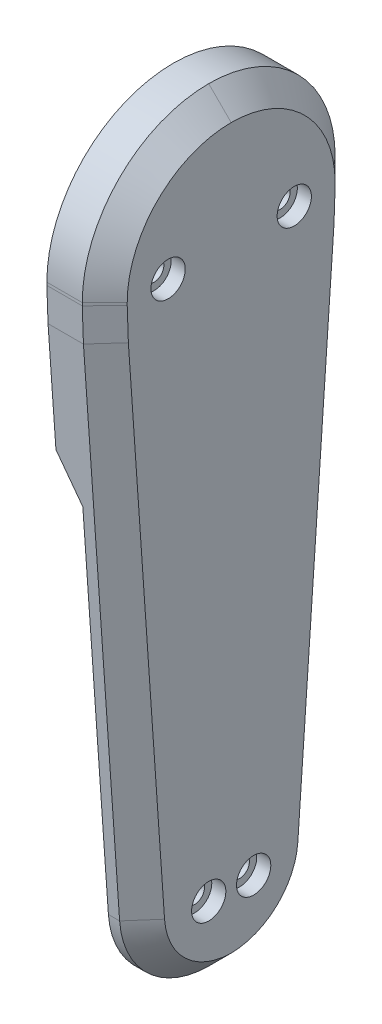
from build123d import *
from OCP.BRepFilletAPI import BRepFilletAPI_MakeChamfer

# Parameters (mm, degrees)
SKETCH1_W           = 20
SKETCH1_H           = 20
BOSS_EXTRUDE1_DEPTH = 20
SKETCH2_W           = 45
SKETCH2_H           = 70
BOSS_EXTRUDE2_DEPTH = 8.3
CUT_EXTRUDE1_DEPTH  = 5.8
FILLET1_R           = 3.6
FILLET2_R           = 10
SKETCH5_R           = 3.9
CUT_EXTRUDE2_DEPTH  = 51.320373608
CUT_EXTRUDE3_REACH  = 49.302
SKETCH6_R           = 1.75
SKETCH13_W          = 20
SKETCH13_H          = 20
CUT_EXTRUDE9_DEPTH  = 20
SKETCH15_W          = 8.3
SKETCH15_H          = 45
CUT_EXTRUDE10_DEPTH = 12.5
SKETCH18_W          = 8.3
SKETCH18_H          = 45
BOSS_EXTRUDE4_DEPTH = 78.5
FILLET5_R           = 22.5
SKETCH20_W          = 45
SKETCH20_H          = 80
CUT_EXTRUDE12_DEPTH = 2.3
CHAMFER2_SIZE       = 110
CHAMFER2_SIZE2      = 7.691949314
CHAMFER3_SIZE       = 3
FILLET6_R           = 16
CHAMFER4_SIZE       = 4
SKETCH21_R          = 1.75
CUT_EXTRUDE15_DEPTH = 116.863759268
SKETCH14_R          = 1.75
CUT_EXTRUDE16_DEPTH = 117.005606381
SKETCH23_W          = 17
SKETCH23_H          = 38.9
BOSS_EXTRUDE5_DEPTH = 8.3
BOSS_EXTRUDE6_START = 2
SKETCH24_R          = 1.75
BOSS_EXTRUDE6_DEPTH = 2
CHAMFER5_SIZE2      = 4.3
CHAMFER5_SIZE       = 6.881438475
SKETCH25_R          = 3.05
CUT_EXTRUDE17_DEPTH = 2.5


# Some blends are built 0.0001 mm under size
with BuildPart() as part:
    # Sketch1 → Boss-Extrude1 (new body)
    with BuildSketch(Plane(origin=(0, 0, 0), x_dir=(0, 0, -1), z_dir=(1, 0, 0))):
        Rectangle(SKETCH1_W, SKETCH1_H)
    extrude(amount=BOSS_EXTRUDE1_DEPTH)

    # Sketch2 → Boss-Extrude2 (add)
    with BuildSketch(Plane(origin=(20, 0, 0), x_dir=(0, 0, -1), z_dir=(1, 0, 0))):
        Rectangle(SKETCH2_W, SKETCH2_H)
    extrude(amount=BOSS_EXTRUDE2_DEPTH)

    # Sketch4 → Cut-Extrude1 (cut)
    with BuildSketch(Plane(origin=(28.3, 0, 0), x_dir=(0, 0, -1), z_dir=(1, 0, 0))):
        with BuildLine():
            Line((3.6, -28.55), (-3.6, -28.55))
            Line((-3.6, -28.55), (-3.6, -7.311805523))
            ThreePointArc((-3.6, -7.311805523), (0, 8.15), (3.6, -7.311805523))
            Line((3.6, -7.311805523), (3.6, -28.55))
        make_face()
    extrude(amount=-CUT_EXTRUDE1_DEPTH, mode=Mode.SUBTRACT)

    # Fillet1
    fillet1_edges = [part.edges().sort_by_distance(p)[0] for p in [
        (25.4, -28.55, 3.6),
        (25.4, -28.55, -3.6),
    ]]
    fillet(fillet1_edges, radius=FILLET1_R - 0.0001)  # a hair under: the kernel refuses the full size

    # Fillet2
    fillet2_edges = [part.edges().sort_by_distance(p)[0] for p in [
        (25.4, -7.311805523, 3.6),
        (25.4, -7.311805523, -3.6),
    ]]
    fillet(fillet2_edges, radius=FILLET2_R)

    # Sketch5 → Cut-Extrude2 (cut, through all)
    with BuildSketch(Plane.ZY):
        Circle(SKETCH5_R)
    extrude(amount=-CUT_EXTRUDE2_DEPTH, mode=Mode.SUBTRACT)

    # Sketch6 → Cut-Extrude3 (cut, up to next)
    with BuildSketch(Plane(origin=(22.5, 0, 0), x_dir=(0, 0, -1), z_dir=(1, 0, 0)), mode=Mode.PRIVATE) as cut_extrude3_sk1:
        with Locations((0, -20.6)):
            Circle(SKETCH6_R)
    cut_extrude3_tool1 = extrude(cut_extrude3_sk1.sketch, amount=-CUT_EXTRUDE3_REACH, mode=Mode.PRIVATE) & part.part
    # Sketch6 → Cut-Extrude3 (cut, up to next)
    with BuildSketch(Plane(origin=(22.5, 0, 0), x_dir=(0, 0, -1), z_dir=(1, 0, 0)), mode=Mode.PRIVATE) as cut_extrude3_sk2:
        with Locations((0, -9.35)):
            Circle(SKETCH6_R)
    cut_extrude3_tool2 = extrude(cut_extrude3_sk2.sketch, amount=-CUT_EXTRUDE3_REACH, mode=Mode.PRIVATE) & part.part
    add(cut_extrude3_tool1.solids().sort_by_distance((22.5, -20.6, 0))[0], mode=Mode.SUBTRACT)
    add(cut_extrude3_tool2.solids().sort_by_distance((22.5, -9.35, 0))[0], mode=Mode.SUBTRACT)

    # Sketch13 → Cut-Extrude9 (cut)
    with BuildSketch(Plane.ZY):
        Rectangle(SKETCH13_W, SKETCH13_H)
    extrude(amount=-CUT_EXTRUDE9_DEPTH, mode=Mode.SUBTRACT)

    # Sketch15 → Cut-Extrude10 (cut)
    with BuildSketch(Plane(origin=(0, 35, 0), x_dir=(1, 0, 0), z_dir=(0, 1, 0))):
        with Locations((24.15, 0)):
            Rectangle(SKETCH15_W, SKETCH15_H)
    extrude(amount=-CUT_EXTRUDE10_DEPTH, mode=Mode.SUBTRACT)

    # Sketch18 → Boss-Extrude4 (add)
    with BuildSketch(Plane.XZ.offset(35)):
        with Locations((24.15, 0)):
            Rectangle(SKETCH18_W, SKETCH18_H)
    extrude(amount=BOSS_EXTRUDE4_DEPTH)

    # Fillet5
    fillet5_edges = [part.edges().sort_by_distance(p)[0] for p in [
        (24.15, 22.5, -22.5),
        (24.15, 22.5, 22.5),
    ]]
    fillet(fillet5_edges, radius=FILLET5_R - 0.0001)  # a hair under: the kernel refuses the full size

    # Sketch20 → Cut-Extrude12 (cut)
    with BuildSketch(Plane.ZY.offset(-20)):
        with Locations((0, -73.5)):
            Rectangle(SKETCH20_W, SKETCH20_H)
    extrude(amount=-CUT_EXTRUDE12_DEPTH, mode=Mode.SUBTRACT)

    # Chamfer2: one chamfer whose edges measure the first distance from different faces: ONE call of the kernel's chamfer builder (chamfer() names one face for all edges)
    chamfer2_edges_1 = [part.edges().sort_by_distance(p)[0] for p in [
        (25.3, -113.5, -22.5),
    ]]
    chamfer2_side_1 = [part.faces().sort_by_distance(p)[0] for p in [
        (24.878183359, -52.68424744, -22.5),
    ]]
    chamfer2_edges_2 = [part.edges().sort_by_distance(p)[0] for p in [
        (25.3, -113.5, 22.5),
    ]]
    chamfer2_side_2 = [part.faces().sort_by_distance(p)[0] for p in [
        (24.878183359, -52.68424744, 22.5),
    ]]
    chamfer2 = BRepFilletAPI_MakeChamfer(part.part.solid().wrapped)
    for e in chamfer2_edges_1:
        chamfer2.Add(CHAMFER2_SIZE, CHAMFER2_SIZE2, e.wrapped, chamfer2_side_1[0].wrapped)  # the first distance lies on this face
    for e in chamfer2_edges_2:
        chamfer2.Add(CHAMFER2_SIZE, CHAMFER2_SIZE2, e.wrapped, chamfer2_side_2[0].wrapped)  # the first distance lies on this face
    add(Compound.cast(chamfer2.Shape()), mode=Mode.REPLACE)

    # Chamfer3
    # the kernel refuses this chamfer: 3 mm, written as the material it takes off along each edge
    with BuildSketch(Plane(origin=(36.099824275, -3.5, -22.5), x_dir=(0, -0.9976567869548854, 0.06841736214481542), z_dir=(-1, 0, 0))) as chamfer3_piece_1:
        Polygon((CHAMFER3_SIZE * 0.99999909909, CHAMFER3_SIZE * 0.00134231857559), (-CHAMFER3_SIZE * 0.997656786955, CHAMFER3_SIZE * 0.0684173621448), (0, 0), align=None)
    extrude(amount=23.89964855, mode=Mode.SUBTRACT)
    with BuildSketch(Plane(origin=(12.200175725, -3.5, 22.5), x_dir=(0, 0.999999099090015, 0.0013423185755924486), z_dir=(1, 0, 0))) as chamfer3_piece_2:
        Polygon((CHAMFER3_SIZE * 0.99999909909, -CHAMFER3_SIZE * 0.00134231857559), (-CHAMFER3_SIZE * 0.997656786955, -CHAMFER3_SIZE * 0.0684173621448), (0, 0), align=None)
    extrude(amount=23.89964855, mode=Mode.SUBTRACT)

    # Fillet6
    # the kernel refuses this fillet: 16 mm, written as the material it takes off along each edge
    with BuildSketch(Plane(origin=(65.600603446, -113.5, -14.808050686), x_dir=(0, 0, 1), z_dir=(-1, 0, 0))) as fillet6_piece_1:
        with BuildLine():
            CenterArc((FILLET6_R * 0.932515086138, FILLET6_R), FILLET6_R, 184, 86)
            Line((-FILLET6_R * 0.0650489641222, FILLET6_R * 0.930243526256), (0, 0))
            Line((0, 0), (FILLET6_R * 0.932515086138, 0))
        make_face()
    extrude(amount=80.601206891, mode=Mode.SUBTRACT)
    with BuildSketch(Plane(origin=(-15.000603446, -113.5, 14.808050686), x_dir=(0, 0.9975640502598242, 0.06975647374412544), z_dir=(1, 0, 0))) as fillet6_piece_2:
        with BuildLine():
            CenterArc((FILLET6_R * 0.932515086138, -FILLET6_R), FILLET6_R, 90, 86)
            Line((-FILLET6_R * 0.0650489641222, -FILLET6_R * 0.930243526256), (0, 0))
            Line((0, 0), (FILLET6_R * 0.932515086138, 0))
        make_face()
    extrude(amount=80.601206891, mode=Mode.SUBTRACT)

    # Chamfer4
    # the kernel refuses this chamfer: 4 mm, written as the material it takes off along each edge
    with BuildSketch(Plane(origin=(28.3, 0.0001, 22.5), x_dir=(0.02749587661058735, 0, -0.9996219169112968), z_dir=(0, -1, 0)), Plane(origin=(28.3, -10.786731952, -22.5), x_dir=(0.027495876610586487, 0, 0.9996219169112968), z_dir=(0, 1, 0))) as chamfer4_piece_1:
        Polygon((CHAMFER4_SIZE * 0.999621916911, -CHAMFER4_SIZE * 0.0274958766106), (-CHAMFER4_SIZE * 0.0274958766106, -CHAMFER4_SIZE * 0.999621916911), (0, 0), align=None)
    extrude(amount=10.786831952, mode=Mode.SUBTRACT)
    with BuildSketch(Plane(origin=(28.3, 0.0001, 0.0001), x_dir=(0, 1, 0), z_dir=(0, 0, -1))) as chamfer4_piece_2:
        Polygon((22.4999 - CHAMFER4_SIZE, 0), (22.4999, -CHAMFER4_SIZE), (22.4999, 0), align=None)
    revolve(axis=Axis((28.3, 0.0001, 0.0001), (1, 0, 0)), revolution_arc=90, mode=Mode.SUBTRACT)
    with BuildSketch(Plane(origin=(28.3, 0.0001, -0.0001), x_dir=(0, 0, -1), z_dir=(0, -1, 0))) as chamfer4_piece_3:
        Polygon((22.4999 - CHAMFER4_SIZE, 0), (22.4999, -CHAMFER4_SIZE), (22.4999, 0), align=None)
    revolve(axis=Axis((28.3, 0.0001, -0.0001), (1, 0, 0)), revolution_arc=90, mode=Mode.SUBTRACT)
    with BuildSketch(Plane(origin=(28.3, 3.768981839, 23.008296726), x_dir=(0.027495876610586473, 0.06973010000107531, -0.9971868881625227), z_dir=(0, -0.9975640502598243, -0.06975647374412554))) as chamfer4_piece_4:
        Polygon((CHAMFER4_SIZE * 0.999621916911, -CHAMFER4_SIZE * 0.0274958766106), (-CHAMFER4_SIZE * 0.0274958766106, -CHAMFER4_SIZE * 0.999621916911), (0, 0), align=None)
    extrude(amount=102.635099363, mode=Mode.SUBTRACT)
    with BuildSketch(Plane(origin=(28.3, 9.780465553, -22.859001768), x_dir=(0.027495876610586487, 0.03488630179317817, 0.9990129742483882), z_dir=(0, -0.9993908270190893, 0.03489949670268572))) as chamfer4_piece_5:
        Polygon((CHAMFER4_SIZE * 0.999621916911, CHAMFER4_SIZE * 0.0274958766106), (-CHAMFER4_SIZE * 0.0274958766106, CHAMFER4_SIZE * 0.999621916911), (0, 0), align=None)
    extrude(amount=26.569808866, mode=Mode.SUBTRACT)
    with BuildSketch(Plane(origin=(28.3, 9.780465553, 22.859001768), x_dir=(0.027495876610586494, 0.034886301793392936, -0.9990129742483806), z_dir=(0, -0.9993908270190818, -0.03489949670290056))) as chamfer4_piece_6:
        Polygon((CHAMFER4_SIZE * 0.999621916911, -CHAMFER4_SIZE * 0.0274958766106), (-CHAMFER4_SIZE * 0.0274958766106, -CHAMFER4_SIZE * 0.999621916911), (0, 0), align=None)
    extrude(amount=26.569808866, mode=Mode.SUBTRACT)
    with BuildSketch(Plane(origin=(28.3, 3.768981839, -23.008296726), x_dir=(0.027495876610586473, 0.06973010000107512, 0.9971868881625227), z_dir=(0, -0.9975640502598243, 0.06975647374412534))) as chamfer4_piece_7:
        Polygon((CHAMFER4_SIZE * 0.999621916911, CHAMFER4_SIZE * 0.0274958766106), (-CHAMFER4_SIZE * 0.0274958766106, CHAMFER4_SIZE * 0.999621916911), (0, 0), align=None)
    extrude(amount=102.635099363, mode=Mode.SUBTRACT)
    with BuildSketch(Plane(origin=(28.3, -97.5, -0.112190692), x_dir=(0, -0.9999754161991546, 0.007011918234514749), z_dir=(0, -0.007011918234514749, -0.9999754161991546))) as chamfer4_piece_8:
        Polygon((16 - CHAMFER4_SIZE, 0), (16, CHAMFER4_SIZE), (16, 0), align=None)
    revolve(axis=Axis((28.3, -97.5, -0.112190692), (-1, 0, 0)), revolution_arc=85.598243387, mode=Mode.SUBTRACT)
    with BuildSketch(Plane(origin=(28.3, -97.5, 0.112190692), x_dir=(0, -0.9999754161989443, -0.0070119182645099615), z_dir=(0, -0.0070119182645099615, 0.9999754161989443))) as chamfer4_piece_9:
        Polygon((16 - CHAMFER4_SIZE, 0), (16, -CHAMFER4_SIZE), (16, 0), align=None)
    revolve(axis=Axis((28.3, -97.5, 0.112190692), (1, 0, 0)), revolution_arc=85.598243385, mode=Mode.SUBTRACT)
    with BuildSketch(Plane(origin=(28.3, 22.5, -0.0001), x_dir=(0.027495876610588214, -0.9996219169112968, 0), z_dir=(0, 0, 1))) as chamfer4_piece_10:
        Polygon((CHAMFER4_SIZE * 0.999621916911, -CHAMFER4_SIZE * 0.0274958766106), (-CHAMFER4_SIZE * 0.0274958766106, -CHAMFER4_SIZE * 0.999621916911), (0, 0), align=None)
    extrude(amount=0.0002, mode=Mode.SUBTRACT)

    # Sketch21 → Cut-Extrude15 (cut, through all)
    with BuildSketch(Plane.ZY.offset(-22.3)):
        with Locations((-4, -99.5)):
            Circle(SKETCH21_R)
        with Locations((4, -99.5)):
            Circle(SKETCH21_R)
    extrude(amount=-CUT_EXTRUDE15_DEPTH, mode=Mode.SUBTRACT)

    # Sketch14 → Cut-Extrude16 (cut, through all)
    with BuildSketch(Plane.ZY.offset(-20)):
        with Locations((-11.225, 0)):
            Circle(SKETCH14_R)
        with Locations((11.225, 0)):
            Circle(SKETCH14_R)
    extrude(amount=-CUT_EXTRUDE16_DEPTH, mode=Mode.SUBTRACT)

    # Sketch23 → Boss-Extrude5 (add, through all)
    with BuildSketch(Plane(origin=(28.3, 0, 0), x_dir=(0, 0, -1), z_dir=(1, 0, 0))):
        with Locations((0, -10.55)):
            Rectangle(SKETCH23_W, SKETCH23_H)
    extrude(amount=-BOSS_EXTRUDE5_DEPTH)

    # Sketch24 → Boss-Extrude6 (add)
    with BuildSketch(Plane.ZY.offset(-20).offset(BOSS_EXTRUDE6_START)):
        with BuildLine():
            Line((20.402195642, -33.5), (22.290730579, -6.492692151))
            Line((22.290730579, -6.492692151), (22.5, -0.5))
            Line((22.5, -0.5), (22.5, 0))
            ThreePointArc((22.5, 0), (15.909902577, 15.909902577), (0, 22.5))
            ThreePointArc((0, 22.5), (-15.909902577, 15.909902577), (-22.5, 0))
            Line((-22.5, 0), (-22.5, -0.5))
            Line((-22.5, -0.5), (-22.290730579, -6.492692151))
            Line((-22.290730579, -6.492692151), (-20.402195642, -33.5))
            Line((-20.402195642, -33.5), (20.402195642, -33.5))
        make_face()
        with Locations((11.225, 0)):
            Circle(SKETCH24_R, mode=Mode.SUBTRACT)
        with Locations((-11.225, 0)):
            Circle(SKETCH24_R, mode=Mode.SUBTRACT)
    extrude(amount=-BOSS_EXTRUDE6_DEPTH)

    # Chamfer5
    chamfer5_edges = [part.edges().sort_by_distance(p)[0] for p in [
        (18, -33.5, 0),
    ]]
    chamfer5_side = [part.faces().sort_by_distance(p)[0] for p in [
        (18, -33.414, 0),
    ]]
    chamfer(chamfer5_edges, length=CHAMFER5_SIZE - 0.0001, length2=CHAMFER5_SIZE2 - 0.0001, reference=chamfer5_side[0])  # a hair under: the kernel refuses the full size

    # Sketch25 → Cut-Extrude17 (cut)
    with BuildSketch(Plane(origin=(28.3, 0, 0), x_dir=(0, 0, -1), z_dir=(1, 0, 0))):
        with Locations((-11.225, 0)):
            Circle(SKETCH25_R)
        with Locations((11.225, 0)):
            Circle(SKETCH25_R)
        with Locations((-4, -99.5)):
            Circle(SKETCH25_R)
        with Locations((4, -99.5)):
            Circle(SKETCH25_R)
    extrude(amount=-CUT_EXTRUDE17_DEPTH, mode=Mode.SUBTRACT)


solid = part.part
